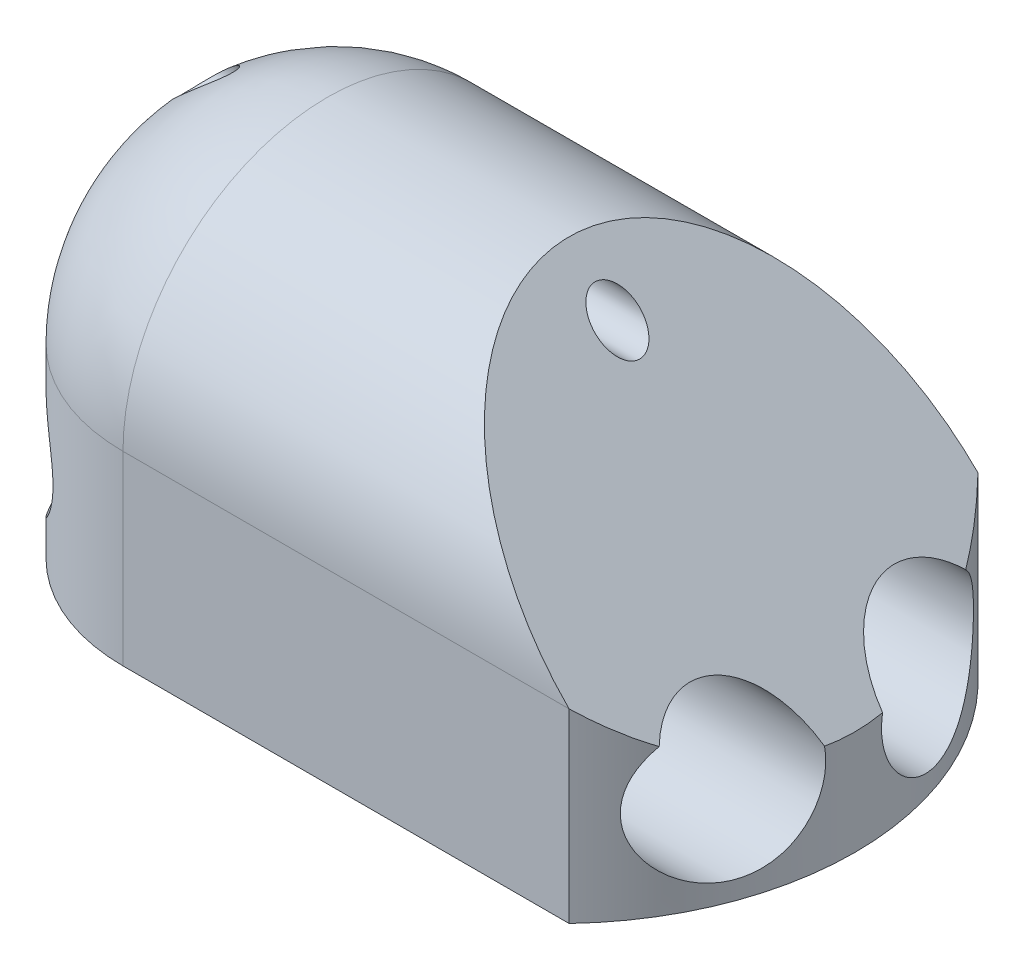
from build123d import *

# Parameters (mm, degrees)
SKETCH1_W                = 21.59
SKETCH1_H                = 13.97
DEPTH_A_DEPTH            = 6.35
ROUND_EXTRUDE_DEPTH      = 21.59
ANGLE_CUT_DEPTH          = 29.967416609
STRING_HOLE_R            = 0.762
STRING_HOLE_CUT_DEPTH    = 29.967416609
ELASTIC_HOLES_R          = 2.54
ELASTIC_HOLE_CUT_DEPTH   = 29.967416609
FILLET1_R                = 6.35
GUIDE_OUTIE_REACH        = 30.967
SKETCH7_R                = 2.54
ELASTIC_HOLE_CUT_2_DEPTH = 29.967416778


with BuildPart() as part:
    # Sketch1 → depth a (new body)
    with BuildSketch(Plane(origin=(0, 0, 0), x_dir=(1, 0, 0), z_dir=(0, 1, 0))):
        with Locations((-10.795, 6.985)):
            Rectangle(SKETCH1_W, SKETCH1_H)
    extrude(amount=DEPTH_A_DEPTH)

    # Sketch4 → round extrude (add)
    with BuildSketch(Plane(origin=(0, 0, 0), x_dir=(0, 0, -1), z_dir=(1, 0, 0))):
        with BuildLine():
            Line((0, 6.35), (13.97, 6.35))
            ThreePointArc((13.97, 6.35), (6.985, 13.335), (0, 6.35))
        make_face()
    extrude(amount=-ROUND_EXTRUDE_DEPTH)

    # Sketch5 → angle cut (cut, through all)
    with BuildSketch(Plane.XY):
        Polygon((0, 6.35), (0, 13.335), (-6.985, 13.335), align=None)
    extrude(amount=-ANGLE_CUT_DEPTH, mode=Mode.SUBTRACT)

    # string hole → string hole cut (cut, through all)
    with BuildSketch(Plane(origin=(0, 0, 0), x_dir=(0, 0, -1), z_dir=(1, 0, 0))):
        with Locations((6.985, 11.684)):
            Circle(STRING_HOLE_R)
    extrude(amount=-STRING_HOLE_CUT_DEPTH, mode=Mode.SUBTRACT)

    # elastic holes → elastic hole cut (cut, through all)
    with BuildSketch(Plane(origin=(0, 0, 0), x_dir=(0, 0, -1), z_dir=(1, 0, 0))):
        with Locations((3.4925, 3.175)):
            Circle(ELASTIC_HOLES_R)
        with Locations(Location((10.4775, 3.175, 0), (0, 0, 180))):
            Circle(ELASTIC_HOLES_R)
    extrude(amount=-ELASTIC_HOLE_CUT_DEPTH, mode=Mode.SUBTRACT)

    # Fillet1
    # the kernel refuses this fillet: 6.35 mm, written as the material it takes off along each edge
    with BuildSketch(Plane(origin=(-21.59, 6.35, -6.985), x_dir=(0, 0, -1), z_dir=(0, -1, 0))) as fillet1_piece_1:
        with BuildLine():
            CenterArc((6.985 - FILLET1_R, FILLET1_R), FILLET1_R, 270, 90)
            Line((6.985, FILLET1_R), (6.985, 0))
            Line((6.985, 0), (6.985 - FILLET1_R, 0))
        make_face()
    revolve(axis=Axis((-21.59, 6.35, -6.985), (1, 0, 0)), revolution_arc=180, mode=Mode.SUBTRACT)
    with BuildSketch(Plane(origin=(-21.59, -15.875, 0), x_dir=(1, 0, 0), z_dir=(0, 1, 0)), Plane(origin=(-21.59, -15.875, -13.97), x_dir=(0, 0, 1), z_dir=(0, 1, 0))) as fillet1_piece_2:
        with BuildLine():
            CenterArc((FILLET1_R, FILLET1_R), FILLET1_R, 180, 90)
            Line((0, FILLET1_R), (0, 0))
            Line((0, 0), (FILLET1_R, 0))
        make_face()
    extrude(amount=22.225, mode=Mode.SUBTRACT)

    # guide outie: up to this plane
    guide_outie_end = Plane(origin=(-6.985, 13.335, -13.97), z_dir=(-0.7071067811865512, -0.7071067811865439, 0))
    # guide → guide outie (add, up to the surface)
    with BuildSketch(Plane(origin=(0, 0, 0), x_dir=(1, 0, 0), z_dir=(0, 1, 0)), mode=Mode.PRIVATE) as guide_outie_sk1:
        with BuildLine():
            Line((0, 13.97), (0, 0))
            ThreePointArc((0, 0), (2.781966725, 6.985), (0, 13.97))
        make_face()
    guide_outie_tool1 = split(extrude(guide_outie_sk1.sketch, amount=GUIDE_OUTIE_REACH, mode=Mode.PRIVATE), bisect_by=guide_outie_end, keep=Keep.BOTH, mode=Mode.PRIVATE)
    add(guide_outie_tool1.solids().sort_by_distance((1.126975, 0, -6.985))[0])

    # Sketch7 → elastic hole cut 2 (cut, through all)
    with BuildSketch(Plane.ZY):
        with Locations(Location((-3.4925, 3.175, 0), (0, 0, 169.990167885))):
            Circle(SKETCH7_R)
        with Locations(Location((-10.4775, 3.175, 0), (0, 0, 180))):
            Circle(SKETCH7_R)
    extrude(amount=-ELASTIC_HOLE_CUT_2_DEPTH, mode=Mode.SUBTRACT)


solid = part.part
